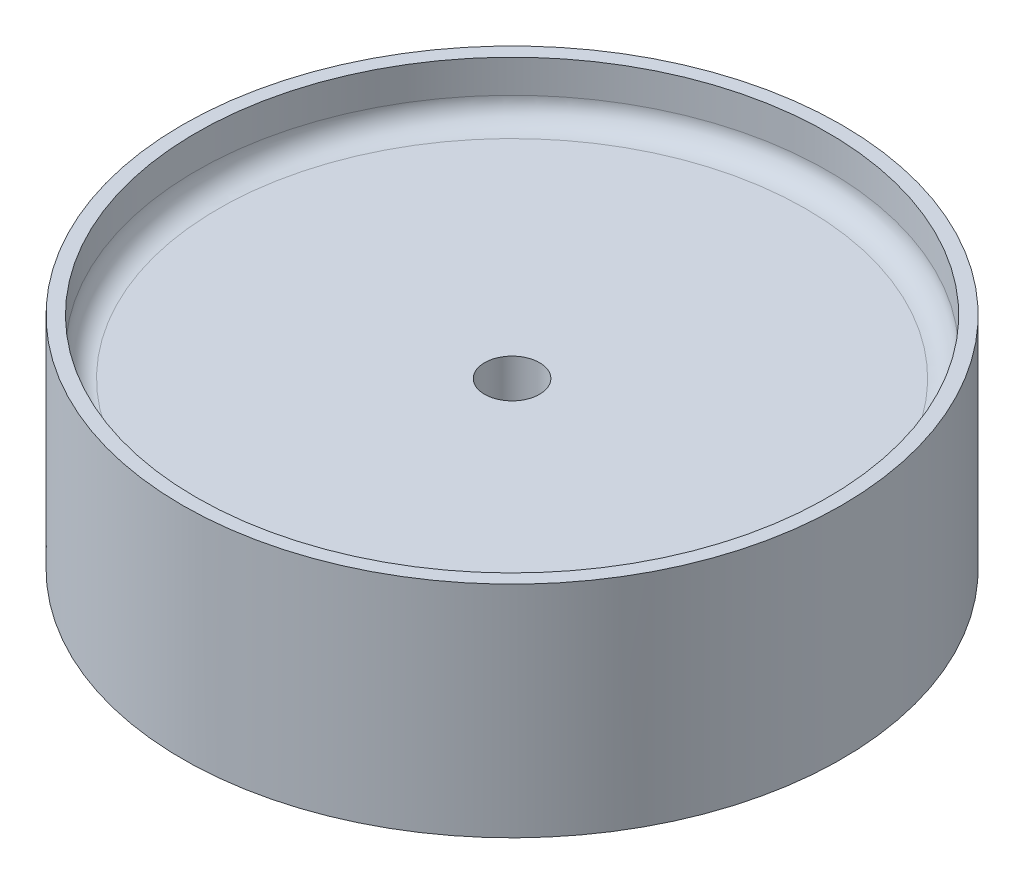
from build123d import *

# Parameters (mm, degrees)
SKETCH1_R           = 38.1
SKETCH1_R_2         = 3.175
BOSS_EXTRUDE1_DEPTH = 12.7
SKETCH2_R           = 38.1
SKETCH2_R_2         = 36.5125
BOSS_EXTRUDE2_DEPTH = 6.35
BOSS_EXTRUDE3_START = 6.35
SKETCH3_R           = 38.1
SKETCH3_R_2         = 36.5125
BOSS_EXTRUDE3_DEPTH = 6.35
FILLET1_R           = 2.54


with BuildPart() as part:
    # Sketch1 → Boss-Extrude1 (new body)
    with BuildSketch(Plane(origin=(0, 0, 0), x_dir=(1, 0, 0), z_dir=(0, 1, 0))):
        Circle(SKETCH1_R)
        Circle(SKETCH1_R_2, mode=Mode.SUBTRACT)
    extrude(amount=BOSS_EXTRUDE1_DEPTH)

    # Sketch2 → Boss-Extrude2 (add)
    with BuildSketch(Plane(origin=(0, 12.7, 0), x_dir=(1, 0, 0), z_dir=(0, 1, 0))):
        Circle(SKETCH2_R)
        Circle(SKETCH2_R_2, mode=Mode.SUBTRACT)
    extrude(amount=BOSS_EXTRUDE2_DEPTH)

    # Sketch3 → Boss-Extrude3 (add)
    with BuildSketch(Plane.XZ.offset(BOSS_EXTRUDE3_START)):
        Circle(SKETCH3_R)
        Circle(SKETCH3_R_2, mode=Mode.SUBTRACT)
    extrude(amount=-BOSS_EXTRUDE3_DEPTH)

    # Fillet1
    fillet1_edges = [part.edges().sort_by_distance(p)[0] for p in [
        (-36.5125, 0, 0),
        (-36.5125, 12.7, 0),
    ]]
    fillet(fillet1_edges, radius=FILLET1_R)


solid = part.part
